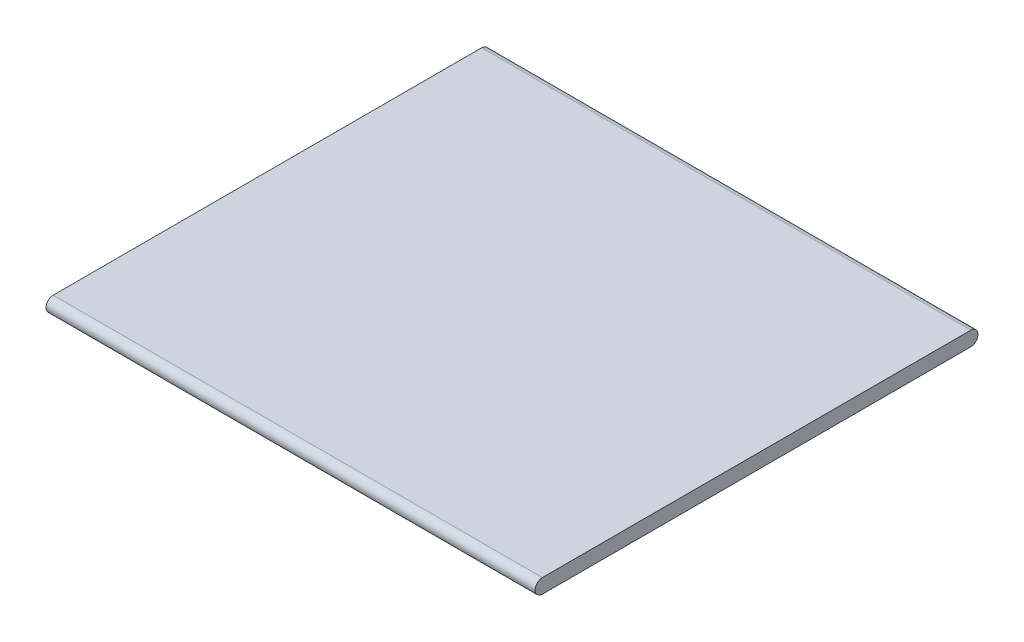
from build123d import *

# Parameters (mm, degrees)
BOSS_EXTRUDE1_DEPTH = 10
CUT_EXTRUDE4_DEPTH  = 3
BOSS_EXTRUDE2_DEPTH = 610
SPLIT1_DEPTH        = 10


# Read off the part's stored shape, not the designer's step: Split1
with BuildPart() as part:
    # Sketch1 → Boss-Extrude1 (new body)
    with BuildSketch(Plane(origin=(0, 0, 0), x_dir=(0, 0, -1), z_dir=(1, 0, 0))):
        with BuildLine():
            Line((0, -14.281480067), (0, -294.281480067))
            ThreePointArc((0, -294.281480067), (8.786796564, -315.494683503), (30, -324.281480067))
            Line((30, -324.281480067), (573.815572472, -324.281480067))
            ThreePointArc((573.815572472, -324.281480067), (580.886640283, -321.352547879), (583.815572472, -314.281480067))
            Line((583.815572472, -314.281480067), (583.815572472, -219.493566063))
            ThreePointArc((583.815572472, -219.493566063), (582.007092914, -213.757801699), (577.235773905, -210.096639855))
            Line((577.235773905, -210.096639855), (13.420201433, -4.88455386))
            ThreePointArc((13.420201433, -4.88455386), (4.264235636, -6.089959625), (0, -14.281480067))
        make_face()
    extrude(amount=BOSS_EXTRUDE1_DEPTH)

    # Sketch3 → Cut-Extrude4 (cut)
    with BuildSketch(Plane.ZY):
        with BuildLine():
            ThreePointArc((-23.162175785, -218.017297737), (-17.576945532, -207.678107035), (-26.738120061, -200.318314743))
            add(Edge.make_bspline(
                [(-26.738120061, -200.318314743), (-45.914354434, -200.660753587), (-151.32107334, -255.510398156), (-414.880335601, -286.385074175), (-542.431128002, -257.731725159), (-546.154906269, -257.731029979)],
                knots=[0, 0, 0, 0, 0.560935224, 0.660935224, 1, 1, 1, 1], degree=3))
            ThreePointArc((-546.154906269, -257.731029979), (-563.288388976, -273.27487263), (-549.474047026, -291.831036849))
            add(Edge.make_bspline(
                [(-549.474047026, -291.831036849), (-474.750080899, -306.502271197), (-284.669923623, -324.572171749), (-143.080818041, -266.034178467), (-23.162175785, -218.017297737)],
                knots=[0, 0, 0, 0, 0.423888314, 1, 1, 1, 1], degree=3))
        make_face()
        with BuildLine():
            ThreePointArc((-26.950185671, -47.737214996), (-28.17113687, -40.715672082), (-35.124917897, -39.154353359))
            add(Edge.make_bspline(
                [(-35.124917897, -39.154353359), (-50.602952828, -45.122445935), (-99.042539, -170.661871263), (-331.224003862, -171.181746235), (-353.169530365, -171.181734297)],
                knots=[0, 0, 0, 0, 0.639195597, 1, 1, 1, 1], degree=3))
            ThreePointArc((-353.169530365, -171.181734297), (-370.309371751, -186.812434708), (-356.32010769, -205.316311305))
            add(Edge.make_bspline(
                [(-356.32010769, -205.316311305), (-352.838937223, -205.964445921), (-121.396454164, -217.989087479), (-35.312726243, -66.629555086), (-26.950185671, -47.737214996)],
                knots=[0, 0, 0, 0, 0.40968467, 1, 1, 1, 1], degree=3))
        make_face()
    extrude(amount=-CUT_EXTRUDE4_DEPTH, mode=Mode.SUBTRACT)

    # Sketch5 → Boss-Extrude2 (add)
    with BuildSketch(Plane(origin=(10, 0, 0), x_dir=(0, 0, -1), z_dir=(1, 0, 0))):
        with BuildLine():
            Line((561.587294138, -296.630106089), (27.291979273, -296.630106089))
            ThreePointArc((27.291979273, -296.630106089), (18.291979273, -305.630106089), (27.291979273, -314.630106089))
            Line((27.291979273, -314.630106089), (561.587294138, -314.630106089))
            ThreePointArc((561.587294138, -314.630106089), (570.587294138, -305.630106089), (561.587294138, -296.630106089))
        make_face()
    extrude(amount=BOSS_EXTRUDE2_DEPTH)

    # Split1 outline → Split1 (cut)
    # profile 1 of 3: a face of its own
    with BuildSketch(Plane.YZ):
        with BuildLine():
            ThreePointArc((-294.281480067, 0), (-315.494683503, -8.786796564), (-324.281480067, -30))
            Line((-324.281480067, -30), (-324.281480067, -573.815572472))
            ThreePointArc((-324.281480067, -573.815572472), (-321.352547879, -580.886640284), (-314.281480067, -583.815572472))
            Line((-314.281480067, -583.815572472), (-219.493566063, -583.815572472))
            ThreePointArc((-219.493566063, -583.815572472), (-213.7578017, -582.007092914), (-210.096639855, -577.235773905))
            Line((-210.096639855, -577.235773905), (-4.88455386, -13.420201433))
            ThreePointArc((-4.88455386, -13.420201433), (-6.089959625, -4.264235637), (-14.281480067, 0))
            Line((-14.281480067, 0), (-294.281480067, 0))
        make_face()
        with BuildLine():
            ThreePointArc((-257.731029979, -546.154906269), (-273.27487263, -563.288388976), (-291.831036849, -549.474047026))
            add(Edge.make_bspline(
                [(-291.831036849, -549.474047026), (-306.502271197, -474.750080899), (-324.572171749, -284.669923623), (-266.034178467, -143.080818041), (-218.017297737, -23.162175785)],
                knots=[0, 0, 0, 0, 0.423888314, 1, 1, 1, 1], degree=3))
            ThreePointArc((-218.017297737, -23.162175785), (-207.678107036, -17.576945532), (-200.318314743, -26.738120061))
            add(Edge.make_bspline(
                [(-200.318314743, -26.738120061), (-200.660753587, -45.914354434), (-255.510398156, -151.32107334), (-286.385074175, -414.880335601), (-257.731725159, -542.431128002), (-257.731029979, -546.154906269)],
                knots=[0, 0, 0, 0, 0.560935224, 0.660935224, 1, 1, 1, 1], degree=3))
        make_face(mode=Mode.SUBTRACT)
        with BuildLine():
            ThreePointArc((-171.181734297, -353.169530365), (-186.812434708, -370.309371751), (-205.316311305, -356.32010769))
            add(Edge.make_bspline(
                [(-205.316311305, -356.32010769), (-205.964445921, -352.838937223), (-217.989087479, -121.396454164), (-66.629555086, -35.312726243), (-47.737214996, -26.950185671)],
                knots=[0, 0, 0, 0, 0.40968467, 1, 1, 1, 1], degree=3))
            ThreePointArc((-47.737214996, -26.950185671), (-40.715672082, -28.17113687), (-39.154353359, -35.124917897))
            add(Edge.make_bspline(
                [(-39.154353359, -35.124917897), (-45.122445935, -50.602952828), (-170.661871263, -99.042539), (-171.181746235, -331.224003862), (-171.181734297, -353.169530365)],
                knots=[0, 0, 0, 0, 0.639195597, 1, 1, 1, 1], degree=3))
        make_face(mode=Mode.SUBTRACT)
    # profile 2 of 3: a face of its own
    with BuildSketch(Plane.YZ):
        with BuildLine():
            add(Edge.make_bspline(
                [(-205.316311305, -356.32010769), (-205.964445921, -352.838937223), (-217.989087479, -121.396454164), (-66.629555086, -35.312726243), (-47.737214996, -26.950185671)],
                knots=[0, 0, 0, 0, 0.40968467, 1, 1, 1, 1], degree=3))
            ThreePointArc((-205.316311305, -356.32010769), (-186.812434708, -370.309371751), (-171.181734297, -353.169530365))
            add(Edge.make_bspline(
                [(-39.154353359, -35.124917897), (-45.122445935, -50.602952828), (-170.661871263, -99.042539), (-171.181746235, -331.224003862), (-171.181734297, -353.169530365)],
                knots=[0, 0, 0, 0, 0.639195597, 1, 1, 1, 1], degree=3))
            ThreePointArc((-39.154353359, -35.124917897), (-40.715672082, -28.17113687), (-47.737214996, -26.950185671))
        make_face()
    # profile 3 of 3: a face of its own
    with BuildSketch(Plane.YZ):
        with BuildLine():
            add(Edge.make_bspline(
                [(-291.831036849, -549.474047026), (-306.502271197, -474.750080899), (-324.572171749, -284.669923623), (-266.034178467, -143.080818041), (-218.017297737, -23.162175785)],
                knots=[0, 0, 0, 0, 0.423888314, 1, 1, 1, 1], degree=3))
            ThreePointArc((-291.831036849, -549.474047026), (-273.27487263, -563.288388976), (-257.731029979, -546.154906269))
            add(Edge.make_bspline(
                [(-200.318314743, -26.738120061), (-200.660753587, -45.914354434), (-255.510398156, -151.32107334), (-286.385074175, -414.880335601), (-257.731725159, -542.431128002), (-257.731029979, -546.154906269)],
                knots=[0, 0, 0, 0, 0.560935224, 0.660935224, 1, 1, 1, 1], degree=3))
            ThreePointArc((-200.318314743, -26.738120061), (-207.678107036, -17.576945532), (-218.017297737, -23.162175785))
        make_face()
    extrude(amount=SPLIT1_DEPTH, mode=Mode.SUBTRACT)


solid = part.part
